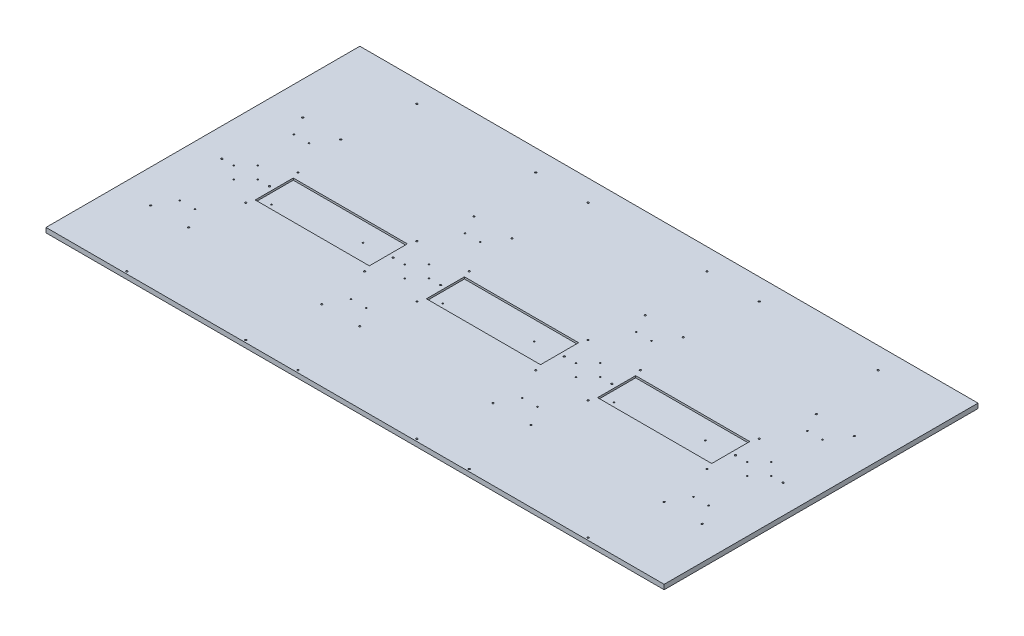
from build123d import *

# Parameters (mm, degrees)
SKETCH1_W               = 800.1
SKETCH1_H               = 419.1
BOSS_EXTRUDE1_DEPTH     = 6.35
SKETCH6_W               = 12.7
SKETCH6_H               = 419.1
BOSS_EXTRUDE2_DEPTH     = 6.35
CUT_EXTRUDE1_DEPTH      = 915.510236411
CUT_EXTRUDE1_DEPTH_BACK = 915.510236411
SKETCH4_R               = 1.1303
SKETCH5_R               = 1.1303
CUT_EXTRUDE2_DEPTH      = 915.510236411
SKETCH7_W               = 152.4
SKETCH7_H               = 50.8
CUT_EXTRUDE3_DEPTH      = 2.54
SKETCH8_R               = 0.889
CUT_EXTRUDE5_DEPTH      = 915.496126892
SKETCH9_R               = 0.889
CUT_EXTRUDE6_DEPTH      = 915.510236411
SKETCH10_R              = 0.889
CUT_EXTRUDE7_DEPTH      = 915.510236411


with BuildPart() as part:
    # Sketch1 → Boss-Extrude1 (new body)
    with BuildSketch(Plane(origin=(0, 0, 0), x_dir=(1, 0, 0), z_dir=(0, 1, 0))):
        with Locations((400.05, 209.55)):
            Rectangle(SKETCH1_W, SKETCH1_H)
    extrude(amount=BOSS_EXTRUDE1_DEPTH)

    # Sketch6 → Boss-Extrude2 (add)
    with BuildSketch(Plane(origin=(0, 6.35, 0), x_dir=(1, 0, 0), z_dir=(0, 1, 0))):
        with Locations((-6.35, 209.55)):
            Rectangle(SKETCH6_W, SKETCH6_H)
        with Locations((806.45, 209.55)):
            Rectangle(SKETCH6_W, SKETCH6_H)
    extrude(amount=-BOSS_EXTRUDE2_DEPTH)

    # Sketch4 → Cut-Extrude1 (cut, two sides: drawn at the far end of the back side and taken through both)
    with BuildSketch(Plane(origin=(0, 6.35, 0), x_dir=(1, 0, 0), z_dir=(0, 1, 0)).offset(-CUT_EXTRUDE1_DEPTH_BACK)):
        with Locations((92.075, 390.525)):
            Circle(SKETCH4_R)
        with Locations((250.825, 231.775)):
            Circle(SKETCH4_R)
        with Locations((250.825, 390.525)):
            Circle(SKETCH4_R)
        with Locations((92.075, 231.775)):
            Circle(SKETCH4_R)
        with Locations((320.675, 390.525)):
            Circle(SKETCH4_R)
        with Locations((320.675, 231.775)):
            Circle(SKETCH4_R)
        with Locations((479.425, 231.775)):
            Circle(SKETCH4_R)
        with Locations((479.425, 390.525)):
            Circle(SKETCH4_R)
        with Locations((549.275, 390.525)):
            Circle(SKETCH4_R)
        with Locations((549.275, 231.775)):
            Circle(SKETCH4_R)
        with Locations((708.025, 231.775)):
            Circle(SKETCH4_R)
        with Locations((708.025, 390.525)):
            Circle(SKETCH4_R)
        with Locations((320.675, 161.925)):
            Circle(SKETCH4_R)
        with Locations((320.675, 3.175)):
            Circle(SKETCH4_R)
        with Locations((479.425, 3.175)):
            Circle(SKETCH4_R)
        with Locations((479.425, 161.925)):
            Circle(SKETCH4_R)
        with Locations((549.275, 161.925)):
            Circle(SKETCH4_R)
        with Locations((549.275, 3.175)):
            Circle(SKETCH4_R)
        with Locations((708.025, 3.175)):
            Circle(SKETCH4_R)
        with Locations((708.025, 161.925)):
            Circle(SKETCH4_R)
        with Locations((92.075, 161.925)):
            Circle(SKETCH4_R)
        with Locations((92.075, 3.175)):
            Circle(SKETCH4_R)
        with Locations((250.825, 3.175)):
            Circle(SKETCH4_R)
        with Locations((250.825, 161.925)):
            Circle(SKETCH4_R)
    extrude(amount=CUT_EXTRUDE1_DEPTH + CUT_EXTRUDE1_DEPTH_BACK, mode=Mode.SUBTRACT)

    # Sketch5 → Cut-Extrude2 (cut, through all)
    with BuildSketch(Plane(origin=(0, 6.35, 0), x_dir=(1, 0, 0), z_dir=(0, 1, 0))):
        with Locations((82.55, 95.25)):
            Circle(SKETCH5_R)
        with Locations((31.75, 95.25)):
            Circle(SKETCH5_R)
        with Locations((82.55, 298.45)):
            Circle(SKETCH5_R)
        with Locations((31.75, 298.45)):
            Circle(SKETCH5_R)
        with Locations((88.9, 196.85)):
            Circle(SKETCH5_R)
        with Locations((25.4, 196.85)):
            Circle(SKETCH5_R)
        with Locations((254, 196.85)):
            Circle(SKETCH5_R)
        with Locations((317.5, 196.85)):
            Circle(SKETCH5_R)
        with Locations((260.35, 95.25)):
            Circle(SKETCH5_R)
        with Locations((311.15, 95.25)):
            Circle(SKETCH5_R)
        with Locations((260.35, 298.45)):
            Circle(SKETCH5_R)
        with Locations((311.15, 298.45)):
            Circle(SKETCH5_R)
        with Locations((482.6, 196.85)):
            Circle(SKETCH5_R)
        with Locations((546.1, 196.85)):
            Circle(SKETCH5_R)
        with Locations((488.95, 95.25)):
            Circle(SKETCH5_R)
        with Locations((539.75, 95.25)):
            Circle(SKETCH5_R)
        with Locations((488.95, 298.45)):
            Circle(SKETCH5_R)
        with Locations((539.75, 298.45)):
            Circle(SKETCH5_R)
        with Locations((711.2, 196.85)):
            Circle(SKETCH5_R)
        with Locations((774.7, 196.85)):
            Circle(SKETCH5_R)
        with Locations((717.55, 95.25)):
            Circle(SKETCH5_R)
        with Locations((768.35, 95.25)):
            Circle(SKETCH5_R)
        with Locations((717.55, 298.45)):
            Circle(SKETCH5_R)
        with Locations((768.35, 298.45)):
            Circle(SKETCH5_R)
    extrude(amount=-CUT_EXTRUDE2_DEPTH, mode=Mode.SUBTRACT)

    # Sketch7 → Cut-Extrude3 (cut)
    with BuildSketch(Plane(origin=(0, 6.35, 0), x_dir=(1, 0, 0), z_dir=(0, 1, 0))):
        with Locations((171.45, 196.85)):
            Rectangle(SKETCH7_W, SKETCH7_H)
        with Locations((400.05, 196.85)):
            Rectangle(SKETCH7_W, SKETCH7_H)
        with Locations((628.65, 196.85)):
            Rectangle(SKETCH7_W, SKETCH7_H)
    extrude(amount=-CUT_EXTRUDE3_DEPTH, mode=Mode.SUBTRACT)

    # Sketch8 → Cut-Extrude5 (cut, through all)
    with BuildSketch(Plane(origin=(0, 3.81, 0), x_dir=(1, 0, 0), z_dir=(0, 1, 0))):
        with Locations((109.168946, 179.451)):
            Circle(SKETCH8_R)
        with Locations((214.249, 196.469)):
            Circle(SKETCH8_R)
        with Locations((442.849, 196.469)):
            Circle(SKETCH8_R)
        with Locations((337.768946, 179.451)):
            Circle(SKETCH8_R)
        with Locations((671.449, 196.469)):
            Circle(SKETCH8_R)
        with Locations((566.368946, 179.451)):
            Circle(SKETCH8_R)
    extrude(amount=-CUT_EXTRUDE5_DEPTH, mode=Mode.SUBTRACT)

    # Sketch9 → Cut-Extrude6 (cut, through all)
    with BuildSketch(Plane(origin=(0, 6.35, 0), x_dir=(1, 0, 0), z_dir=(0, 1, 0))):
        with Locations((40.985567, 196.85)):
            Circle(SKETCH9_R)
        with Locations((57.15, 213.014433)):
            Circle(SKETCH9_R)
        with Locations((73.314433, 196.85)):
            Circle(SKETCH9_R)
        with Locations((57.15, 180.685567)):
            Circle(SKETCH9_R)
        with Locations((269.585567, 196.85)):
            Circle(SKETCH9_R)
        with Locations((285.75, 213.014433)):
            Circle(SKETCH9_R)
        with Locations((301.914433, 196.85)):
            Circle(SKETCH9_R)
        with Locations((285.75, 180.685567)):
            Circle(SKETCH9_R)
        with Locations((498.185567, 196.85)):
            Circle(SKETCH9_R)
        with Locations((514.35, 213.014433)):
            Circle(SKETCH9_R)
        with Locations((530.514433, 196.85)):
            Circle(SKETCH9_R)
        with Locations((514.35, 180.685567)):
            Circle(SKETCH9_R)
        with Locations((726.785567, 196.85)):
            Circle(SKETCH9_R)
        with Locations((742.95, 213.014433)):
            Circle(SKETCH9_R)
        with Locations((759.114433, 196.85)):
            Circle(SKETCH9_R)
        with Locations((742.95, 180.685567)):
            Circle(SKETCH9_R)
    extrude(amount=-CUT_EXTRUDE6_DEPTH, mode=Mode.SUBTRACT)

    # Sketch10 → Cut-Extrude7 (cut, through all)
    with BuildSketch(Plane(origin=(0, 6.35, 0), x_dir=(1, 0, 0), z_dir=(0, 1, 0))):
        with Locations((45.296767183, 273.05)):
            Circle(SKETCH10_R)
        with Locations((65.616767183, 273.05)):
            Circle(SKETCH10_R)
        with Locations((65.616767183, 120.65)):
            Circle(SKETCH10_R)
        with Locations((45.296767183, 120.65)):
            Circle(SKETCH10_R)
        with Locations((273.896767183, 120.65)):
            Circle(SKETCH10_R)
        with Locations((294.216767183, 120.65)):
            Circle(SKETCH10_R)
        with Locations((273.896767183, 273.05)):
            Circle(SKETCH10_R)
        with Locations((294.216767183, 273.05)):
            Circle(SKETCH10_R)
        with Locations((502.496767183, 120.65)):
            Circle(SKETCH10_R)
        with Locations((522.816767183, 120.65)):
            Circle(SKETCH10_R)
        with Locations((502.496767183, 273.05)):
            Circle(SKETCH10_R)
        with Locations((522.816767183, 273.05)):
            Circle(SKETCH10_R)
        with Locations((731.096767183, 120.65)):
            Circle(SKETCH10_R)
        with Locations((751.416767183, 120.65)):
            Circle(SKETCH10_R)
        with Locations((731.096767183, 273.05)):
            Circle(SKETCH10_R)
        with Locations((751.416767183, 273.05)):
            Circle(SKETCH10_R)
    extrude(amount=-CUT_EXTRUDE7_DEPTH, mode=Mode.SUBTRACT)


solid = part.part
